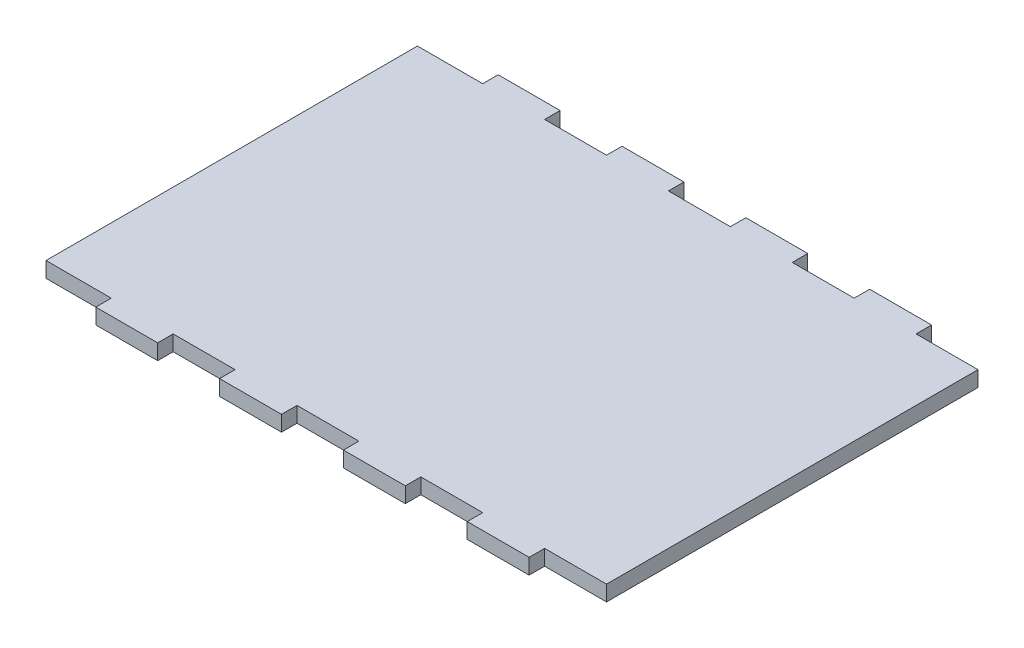
from build123d import *

# Parameters (mm, degrees)
SKETCH1_W           = 229.969358589
SKETCH1_H           = 6.35
BOSS_EXTRUDE1_DEPTH = 152.4
SKETCH2_W           = 25.4
SKETCH2_H           = 6.35
BOSS_EXTRUDE2_DEPTH = 6.35
LPATTERN1_COUNT     = 4
LPATTERN1_PITCH     = 50.8
SKETCH3_W           = 25.4
SKETCH3_H           = 6.35
BOSS_EXTRUDE3_DEPTH = 6.35
LPATTERN2_COUNT     = 4
LPATTERN2_PITCH     = 50.8


with BuildPart() as part:
    # Sketch1 → Boss-Extrude1 (new body)
    with BuildSketch(Plane.XY):
        with Locations((-24.365205383, 152.4)):
            Rectangle(SKETCH1_W, SKETCH1_H)
    extrude(amount=BOSS_EXTRUDE1_DEPTH)

    # Sketch2 → Boss-Extrude2 (add)
    with BuildSketch(Plane(origin=(0, 155.575, 0), x_dir=(1, 0, 0), z_dir=(0, 1, 0))):
        with Locations((52.519473912, 3.175)):
            Rectangle(SKETCH2_W, SKETCH2_H)
    boss_extrude2 = extrude(amount=-BOSS_EXTRUDE2_DEPTH)

    # LPattern1: Boss-Extrude2 ×4
    with Locations(*[(-i * LPATTERN1_PITCH, 0, 0) for i in range(1, LPATTERN1_COUNT)]):
        add(boss_extrude2)

    # Sketch3 → Boss-Extrude3 (add)
    with BuildSketch(Plane.XY.offset(152.4)):
        with Locations((52.519473912, 152.4)):
            Rectangle(SKETCH3_W, SKETCH3_H)
    boss_extrude3 = extrude(amount=BOSS_EXTRUDE3_DEPTH)

    # LPattern2: Boss-Extrude3 ×4
    with Locations(*[(-i * LPATTERN2_PITCH, 0, 0) for i in range(1, LPATTERN2_COUNT)]):
        add(boss_extrude3)


solid = part.part
